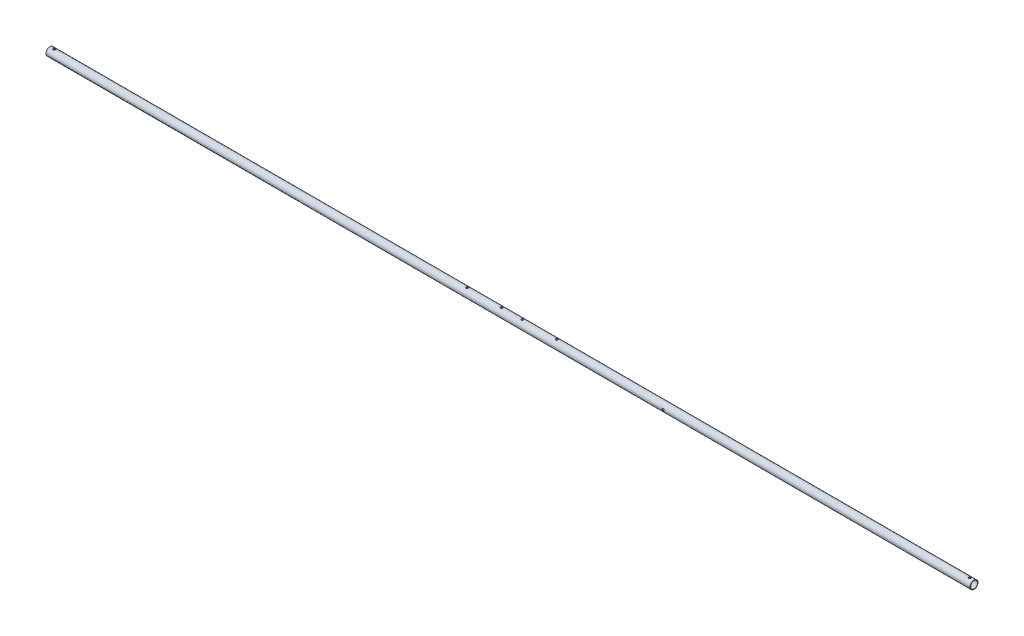
from build123d import *

# Parameters (mm, degrees)
SKETCH3_R               = 11.7094
SKETCH3_R_2             = 10.4648
BOSS_EXTRUDE1_DEPTH     = 2724.912
CUT_EXTRUDE1_DEPTH      = 2725.962316774
CUT_EXTRUDE1_DEPTH_BACK = 2725.962316774
SKETCH4_R               = 3.175
CUT_EXTRUDE2_DEPTH      = 2725.962316875
CUT_EXTRUDE2_DEPTH_BACK = 2725.962316875
SKETCH5_R               = 3.175
CUT_EXTRUDE3_DEPTH      = 2725.962316875
CUT_EXTRUDE3_DEPTH_BACK = 2725.962316875
SKETCH7_R               = 3.175


with BuildPart() as part:
    # Sketch3 → Boss-Extrude1 (new body)
    with BuildSketch(Plane(origin=(0, 0, 0), x_dir=(0, 0, -1), z_dir=(1, 0, 0))):
        Circle(SKETCH3_R)
        Circle(SKETCH3_R_2, mode=Mode.SUBTRACT)
    extrude(amount=BOSS_EXTRUDE1_DEPTH)

    # Sketch4 → Cut-Extrude1 (cut, two sides: drawn at the far end of the back side and taken through both)
    with BuildSketch(Plane(origin=(0, 0, 0), x_dir=(1, 0, 0), z_dir=(0, 1, 0)).offset(-CUT_EXTRUDE1_DEPTH_BACK)):
        with Locations((1331.976, 0)):
            Circle(SKETCH4_R)
        with Locations((1392.936, 0)):
            Circle(SKETCH4_R)
        with Locations((1494.6376, 0)):
            Circle(SKETCH4_R)
        with Locations((1230.2744, 0)):
            Circle(SKETCH4_R)
    extrude(amount=CUT_EXTRUDE1_DEPTH + CUT_EXTRUDE1_DEPTH_BACK, mode=Mode.SUBTRACT)

    # Sketch5 → Cut-Extrude2 (cut, two sides: drawn at the far end of the back side and taken through both)
    with BuildSketch(Plane(origin=(0, 0, 0), x_dir=(1, 0, 0), z_dir=(0, 1, 0)).offset(-CUT_EXTRUDE2_DEPTH_BACK)):
        with Locations((12.7, 0)):
            Circle(SKETCH5_R)
        with Locations((2712.212, 0)):
            Circle(SKETCH5_R)
    extrude(amount=CUT_EXTRUDE2_DEPTH + CUT_EXTRUDE2_DEPTH_BACK, mode=Mode.SUBTRACT)

    # Sketch7 → Cut-Extrude3 (cut, two sides: drawn at the far end of the back side and taken through both)
    with BuildSketch(Plane.XY.offset(-CUT_EXTRUDE3_DEPTH_BACK)):
        with Locations((1819.656, 0)):
            Circle(SKETCH7_R)
    extrude(amount=CUT_EXTRUDE3_DEPTH + CUT_EXTRUDE3_DEPTH_BACK, mode=Mode.SUBTRACT)


solid = part.part
